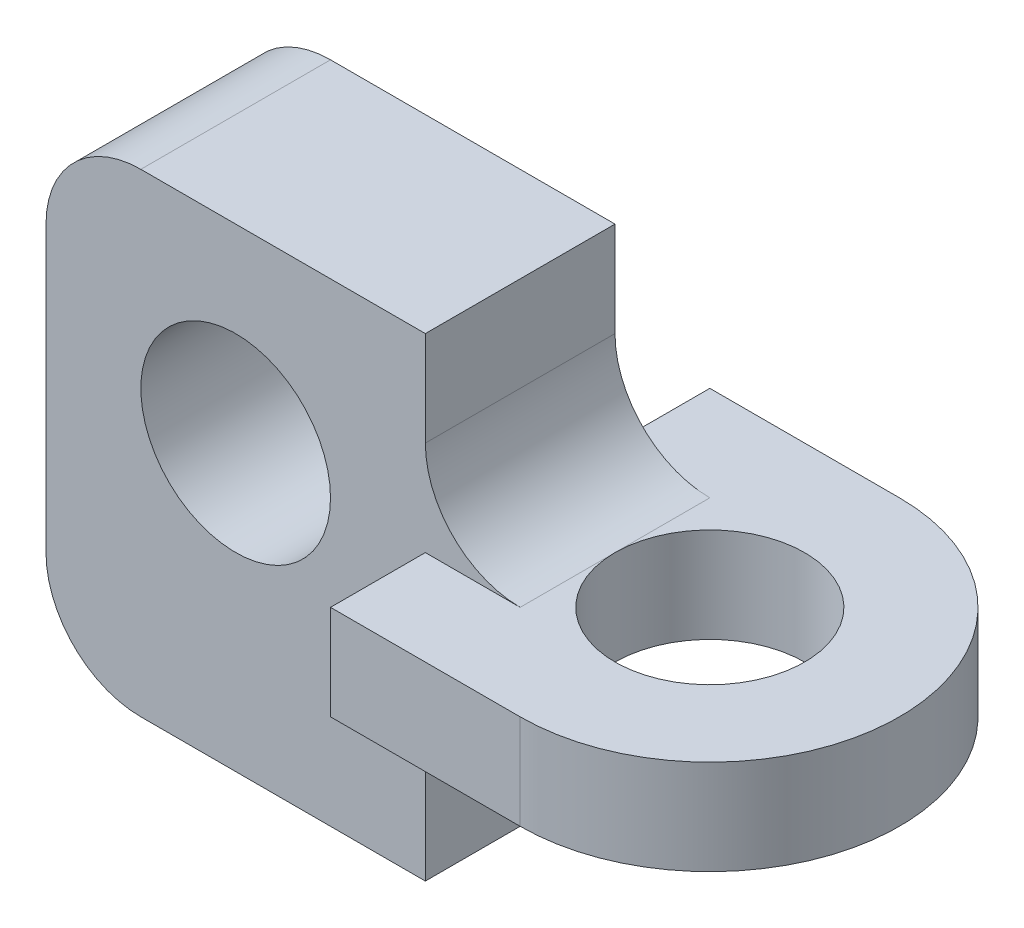
from build123d import *

# Parameters (mm, degrees)
SKETCH_1_W      = 20
SKETCH_1_H      = 25
SKETCH_1_R      = 5
EXTRUDE_1_DEPTH = 5
SKETCH_2_R      = 5
EXTRUDE_2_DEPTH = 2.5
FILLET_1_R      = 5


with BuildPart() as part:
    # 草圖1 → 填料-伸長1 (new, symmetric)
    with BuildSketch(Plane.XY):
        with Locations((0, -2.5)):
            Rectangle(SKETCH_1_W, SKETCH_1_H)
        Circle(SKETCH_1_R, mode=Mode.SUBTRACT)
    extrude(amount=EXTRUDE_1_DEPTH, both=True)

    # 草圖2 → 填料-伸長2 (add, symmetric)
    with BuildSketch(Plane(origin=(0, -2.5, 0), x_dir=(1, 0, 0), z_dir=(0, 1, 0))):
        with BuildLine():
            Line((20, 10), (10, 10))
            Line((10, 10), (10, -10))
            Line((10, -10), (20, -10))
            ThreePointArc((20, -10), (30, 0), (20, 10))
        make_face()
        with Locations(Location((20, 0, 0), (0, 0, 180))):
            Circle(SKETCH_2_R, mode=Mode.SUBTRACT)
    extrude(amount=EXTRUDE_2_DEPTH, both=True)

    # 圓角1
    fillet_1_edges = [part.edges().sort_by_distance(p)[0] for p in [
        (-10, 10, 0),
    ]]
    fillet(fillet_1_edges, radius=FILLET_1_R)
    fillet_1_2_edges = [part.edges().sort_by_distance(p)[0] for p in [
        (-10, -15, 0),
    ]]
    fillet(fillet_1_2_edges, radius=FILLET_1_R)
    fillet_1_3_edges = [part.edges().sort_by_distance(p)[0] for p in [
        (10, 0, 0),
    ]]
    fillet(fillet_1_3_edges, radius=FILLET_1_R - 0.0001)  # a hair under: the kernel refuses the full size
    fillet_1_4_edges = [part.edges().sort_by_distance(p)[0] for p in [
        (10, -5, 0),
    ]]
    fillet(fillet_1_4_edges, radius=FILLET_1_R - 0.0001)  # a hair under: the kernel refuses the full size


solid = part.part
